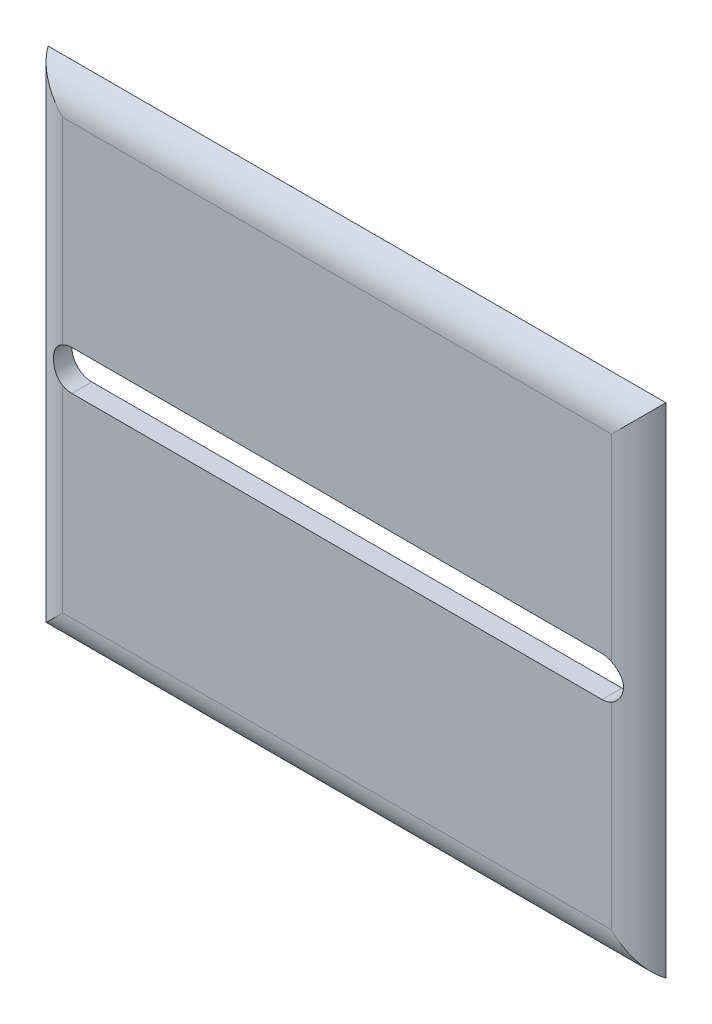
from build123d import *

# Parameters (mm, degrees)
SKETCH_1_W      = 155
SKETCH_1_H      = 125
EXTRUDE_1_DEPTH = 5
FILLET_1_R      = 10


with BuildPart() as part:
    # 草图1 → 凸台-拉伸1 (new body)
    with BuildSketch(Plane.XY):
        with Locations((77.5, 62.5)):
            Rectangle(SKETCH_1_W, SKETCH_1_H)
        with BuildLine():
            Line((11, 67.5), (144, 67.5))
            ThreePointArc((144, 67.5), (149, 62.5), (144, 57.5))
            Line((144, 57.5), (11, 57.5))
            ThreePointArc((11, 57.5), (6, 62.5), (11, 67.5))
        make_face(mode=Mode.SUBTRACT)
    extrude(amount=EXTRUDE_1_DEPTH)

    # 圆角1
    # the kernel refuses this fillet: 10 mm, written as the material it takes off along each edge
    with BuildSketch(Plane(origin=(0, 146.650635095, 5), x_dir=(0, 0, -1), z_dir=(0, -1, 0)), Plane(origin=(155, -21.650635095, 5), x_dir=(0, 0, -1), z_dir=(0, 1, 0))) as fillet_1_piece_1:
        with BuildLine():
            CenterArc((10, 8.660254038), FILLET_1_R, 180, 60)
            Line((0, 8.660254038), (-0.2, 8.660254038))
            Line((-0.2, 8.660254038), (-0.2, 0))
            Line((-0.2, 0), (0, -0.2))
            ThreePointArc((0, -0.2), (2.5, -0.2), (4.9, -0.173205081))
            Line((4.9, -0.173205081), (5, 0))
        make_face()
    extrude(amount=168.301270189, mode=Mode.SUBTRACT)
    with BuildSketch(Plane(origin=(-21.650635095, 0, 5), x_dir=(0, 0, -1), z_dir=(1, 0, 0)), Plane(origin=(176.650635095, 125, 5), x_dir=(0, 0, -1), z_dir=(-1, 0, 0))) as fillet_1_piece_2:
        with BuildLine():
            CenterArc((10, 8.660254038), FILLET_1_R, 180, 60)
            Line((0, 8.660254038), (-0.2, 8.660254038))
            Line((-0.2, 8.660254038), (-0.2, 0))
            Line((-0.2, 0), (0, -0.2))
            ThreePointArc((0, -0.2), (2.5, -0.2), (4.9, -0.173205081))
            Line((4.9, -0.173205081), (5, 0))
        make_face()
    extrude(amount=198.301270189, mode=Mode.SUBTRACT)


solid = part.part
